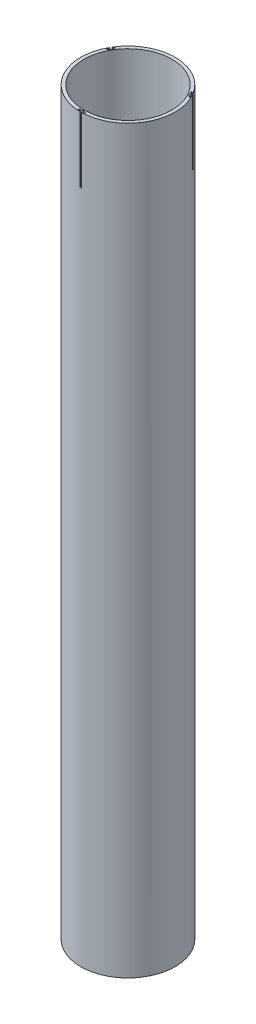
from build123d import *

# Parameters (mm, degrees)
SKETCH1_R           = 57.5
BOSS_EXTRUDE1_DEPTH = 450
SHELL1_T            = -4
CUT_EXTRUDE4_DEPTH  = 80
CIRPATTERN1_COUNT   = 3


with BuildPart() as part:
    # Sketch1 → Boss-Extrude1 (new, symmetric)
    with BuildSketch(Plane(origin=(0, 0, 0), x_dir=(1, 0, 0), z_dir=(0, 1, 0))):
        Circle(SKETCH1_R)
    extrude(amount=BOSS_EXTRUDE1_DEPTH, both=True)

    # Shell1
    shell1_openings = [part.faces().sort_by_distance(p)[0] for p in [
        (0, 450, 0),
        (0, -450, 0),
    ]]
    offset(amount=SHELL1_T, openings=shell1_openings, kind=Kind.INTERSECTION)

    # Sketch2 → Cut-Extrude4 (cut)
    with BuildSketch(Plane(origin=(0, 450, 0), x_dir=(1, 0, 0), z_dir=(0, 1, 0))):
        with BuildLine():
            Line((1, -57.49130369), (1, -56.50869631))
            Line((1, -56.50869631), (4, -56.50869631))
            Line((4, -56.50869631), (4, -55.50869631))
            Line((4, -55.50869631), (0, -54.50869631))
            Line((0, -54.50869631), (-4, -55.50869631))
            Line((-4, -55.50869631), (-4, -56.50869631))
            Line((-4, -56.50869631), (-1, -56.50869631))
            Line((-1, -56.50869631), (-1, -57.49130369))
            ThreePointArc((-1, -57.49130369), (0, -57.5), (1, -57.49130369))
        make_face()
    cut_extrude4 = extrude(amount=-CUT_EXTRUDE4_DEPTH, mode=Mode.SUBTRACT)

    # CirPattern1: Cut-Extrude4 ×3 about axis
    cirpattern1_axis = Axis((0, 0, 0), (0, 1, 0))
    for i in range(1, CIRPATTERN1_COUNT):
        add(cut_extrude4.rotate(cirpattern1_axis, i * 360 / CIRPATTERN1_COUNT), mode=Mode.SUBTRACT)


solid = part.part
